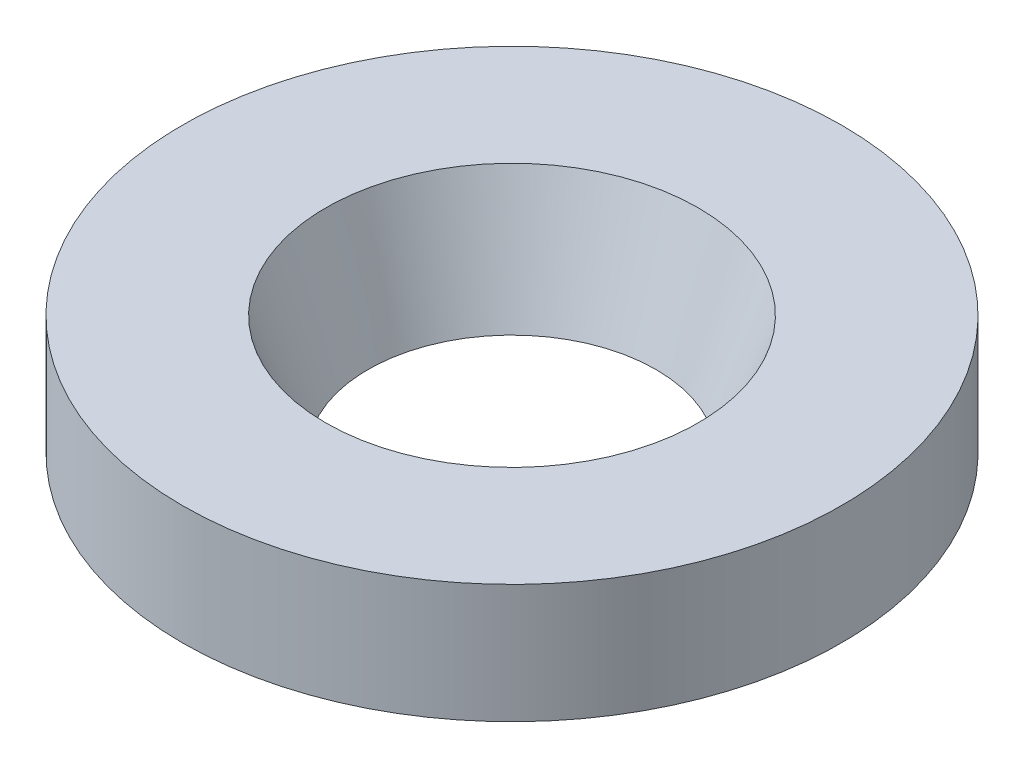
from build123d import *

# Parameters (mm, degrees)
SKETCH1_R           = 5.842
SKETCH1_R_2         = 3.302
BOSS_EXTRUDE1_DEPTH = 2.1082


with BuildPart() as part:
    # Sketch1 → Boss-Extrude1 (new body)
    with BuildSketch(Plane(origin=(0, 0, 0), x_dir=(1, 0, 0), z_dir=(0, 1, 0))):
        Circle(SKETCH1_R)
        Circle(SKETCH1_R_2, mode=Mode.SUBTRACT)
    extrude(amount=BOSS_EXTRUDE1_DEPTH)

    # Sketch3 → Revolve1 (revolve)
    with BuildSketch(Plane.XY):
        Polygon((-3.302, 2.1082), (-2.5527, 0), (-3.302, 0), align=None)
    revolve(axis=Axis((0, 0, 0), (0, 1, 0)))


solid = part.part
